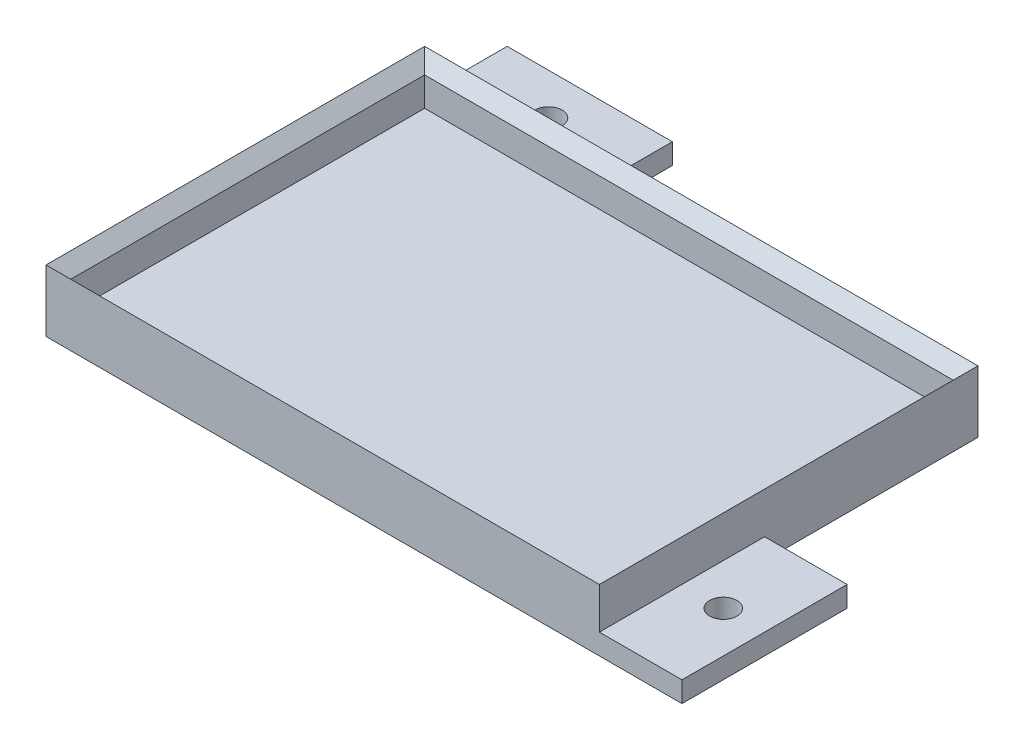
from build123d import *

# Parameters (mm, degrees)
SKETCH1_W            = 134
SKETCH1_H            = 91.68
BOSS_EXTRUDE1_DEPTH  = 5
SKETCH2_W            = 40
SKETCH2_H            = 20
SKETCH2_W_2          = 20
SKETCH2_H_2          = 40
BOSS_EXTRUDE2_DEPTH  = 5
M6_CLEARANCE_HOLE1_D = 6.6
SKETCH6_W            = 134
SKETCH6_H            = 91.68
SKETCH6_W_2          = 128
SKETCH6_H_2          = 85.68
BOSS_EXTRUDE3_DEPTH  = 10
CHAMFER1_SIZE        = 3


with BuildPart() as part:
    # Sketch1 → Boss-Extrude1 (new body)
    with BuildSketch(Plane(origin=(0, 0, 0), x_dir=(1, 0, 0), z_dir=(0, 1, 0))):
        Rectangle(SKETCH1_W, SKETCH1_H)
    extrude(amount=BOSS_EXTRUDE1_DEPTH)

    # Sketch2 → Boss-Extrude2 (add)
    with BuildSketch(Plane(origin=(0, 0, 0), x_dir=(1, 0, 0), z_dir=(0, 1, 0))):
        with Locations((-47, 55.84)):
            Rectangle(SKETCH2_W, SKETCH2_H)
        with Locations((77, -25.84)):
            Rectangle(SKETCH2_W_2, SKETCH2_H_2)
    extrude(amount=BOSS_EXTRUDE2_DEPTH)

    # M6 Clearance Hole1 (through all)
    with Locations(Plane(origin=(0, 5, 0), x_dir=(1, 0, 0), z_dir=(0, 1, 0))):
        with Locations((-47, 55.84), (77, -25.84)):
            Hole(M6_CLEARANCE_HOLE1_D / 2)

    # Sketch6 → Boss-Extrude3 (add)
    with BuildSketch(Plane(origin=(0, 5, 0), x_dir=(1, 0, 0), z_dir=(0, 1, 0))):
        Rectangle(SKETCH6_W, SKETCH6_H)
        Rectangle(SKETCH6_W_2, SKETCH6_H_2, mode=Mode.SUBTRACT)
    extrude(amount=BOSS_EXTRUDE3_DEPTH)

    # Chamfer1
    chamfer1_edges = [part.edges().sort_by_distance(p)[0] for p in [
        (-64, 15, 0),
        (0, 15, 42.84),
        (64, 15, 0),
        (0, 15, -42.84),
    ]]
    chamfer(chamfer1_edges, length=CHAMFER1_SIZE - 0.0001)  # a hair under: the kernel refuses the full size


solid = part.part
